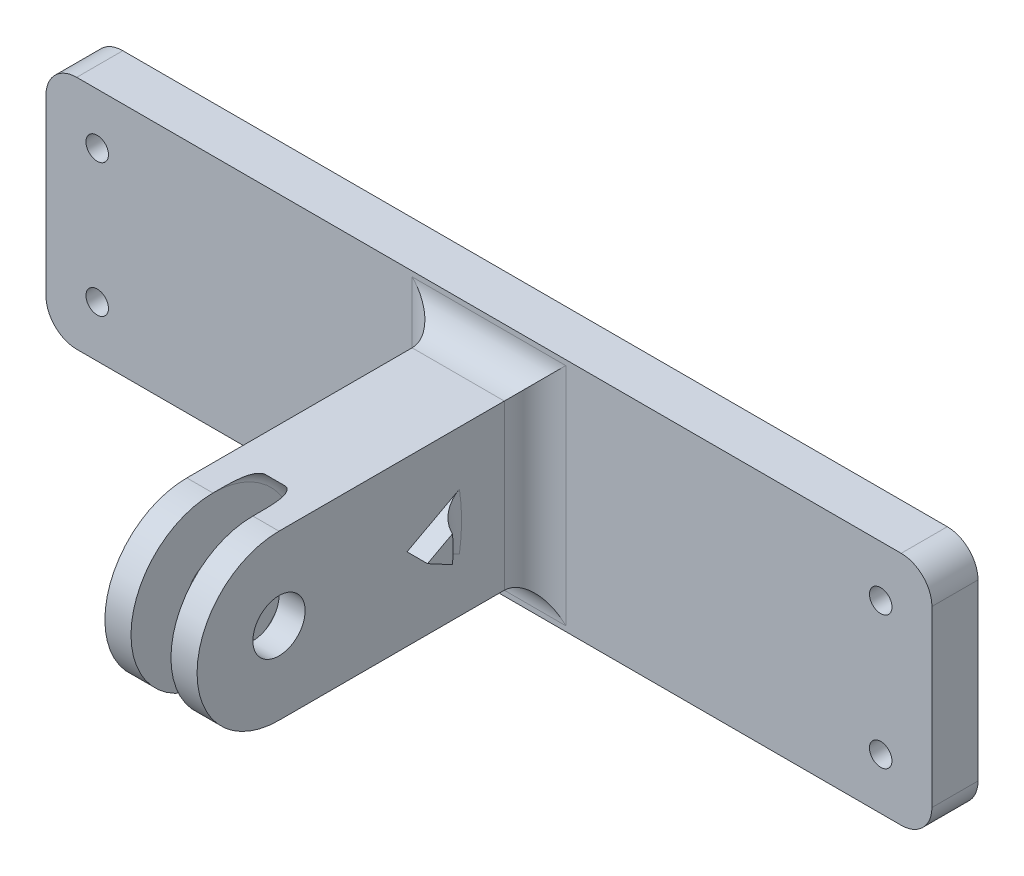
from build123d import *

# Parameters (mm, degrees)
SKETCH1_W           = 86.5
SKETCH1_H           = 23
SKETCH1_R           = 1.1
BOSS_EXTRUDE1_DEPTH = 4.5
CUT_EXTRUDE1_DEPTH  = 2
SKETCH3_R           = 2.55
BOSS_EXTRUDE2_DEPTH = 4.5
SKETCH6_R           = 9
CUT_EXTRUDE3_DEPTH  = 1.95
FILLET1_R           = 3
FILLET2_R           = 1
FILLET3_R           = 1
BOSS_EXTRUDE3_DEPTH = 2
FILLET4_R           = 3


with BuildPart() as part:
    # Sketch1 → Boss-Extrude1 (new body)
    with BuildSketch(Plane.XY):
        Rectangle(SKETCH1_W, SKETCH1_H)
        with Locations((38.25, 6.5)):
            Circle(SKETCH1_R, mode=Mode.SUBTRACT)
        with Locations((38.25, -6.5)):
            Circle(SKETCH1_R, mode=Mode.SUBTRACT)
        with Locations((-38.25, -6.5)):
            Circle(SKETCH1_R, mode=Mode.SUBTRACT)
        with Locations((-38.25, 6.5)):
            Circle(SKETCH1_R, mode=Mode.SUBTRACT)
    extrude(amount=BOSS_EXTRUDE1_DEPTH)

    # Sketch2 → Cut-Extrude1 (cut)
    with BuildSketch(Plane(origin=(0, 0, 0), x_dir=(-1, 0, 0), z_dir=(0, 0, -1))):
        with BuildLine():
            Line((-5, 9.5), (-35.604248689, 9.5))
            ThreePointArc((-35.604248689, 9.5), (-34.508342613, 5.085786438), (-38.25, 2.5))
            Line((-38.25, 2.5), (-38.25, -2.5))
            ThreePointArc((-38.25, -2.5), (-34.508342613, -5.085786438), (-35.604248689, -9.5))
            Line((-35.604248689, -9.5), (-5, -9.5))
            Line((-5, -9.5), (-5, 9.5))
        make_face()
        with BuildLine():
            Line((35.604248689, 9.5), (5, 9.5))
            Line((5, 9.5), (5, -9.5))
            Line((5, -9.5), (35.604248689, -9.5))
            ThreePointArc((35.604248689, -9.5), (34.508342613, -5.085786438), (38.25, -2.5))
            Line((38.25, -2.5), (38.25, 2.5))
            ThreePointArc((38.25, 2.5), (34.508342613, 5.085786438), (35.604248689, 9.5))
        make_face()
    extrude(amount=-CUT_EXTRUDE1_DEPTH, mode=Mode.SUBTRACT)

    # Sketch3 → Boss-Extrude2 (add, symmetric)
    with BuildSketch(Plane(origin=(0, 0, 0), x_dir=(0, 0, -1), z_dir=(1, 0, 0))):
        with BuildLine():
            Line((-29.5, 8), (-4.5, 8))
            Line((-4.5, 8), (-4.5, -8))
            Line((-4.5, -8), (-29.5, -8))
            ThreePointArc((-29.5, -8), (-37.5, 0), (-29.5, 8))
        make_face()
        with Locations((-29.5, 0)):
            Circle(SKETCH3_R, mode=Mode.SUBTRACT)
    extrude(amount=BOSS_EXTRUDE2_DEPTH, both=True)

    # Sketch6 → Cut-Extrude3 (cut, symmetric)
    with BuildSketch(Plane(origin=(0, 0, 0), x_dir=(0, 0, -1), z_dir=(1, 0, 0))):
        with Locations((-29.5, 0)):
            Circle(SKETCH6_R)
    extrude(amount=CUT_EXTRUDE3_DEPTH, both=True, mode=Mode.SUBTRACT)

    # Fillet1
    fillet1_edges = [part.edges().sort_by_distance(p)[0] for p in [
        (4.5, 0, 4.5),
        (-4.5, 0, 4.5),
        (0, -8, 4.5),
        (0, 8, 4.5),
        (43.25, -11.5, 2.25),
        (-43.25, -11.5, 2.25),
        (-43.25, 11.5, 2.25),
        (43.25, 11.5, 2.25),
    ]]
    fillet(fillet1_edges, radius=FILLET1_R)

    # Fillet2
    fillet2_edges = [part.edges().sort_by_distance(p)[0] for p in [
        (1.95, 0, 20.5),
        (-1.95, 0, 20.5),
    ]]
    fillet(fillet2_edges, radius=FILLET2_R)

    # Fillet3
    fillet3_edges = [part.edges().sort_by_distance(p)[0] for p in [
        (35.604248689, -9.5, 1),
        (38.25, -2.5, 1),
        (38.25, 2.5, 1),
        (35.604248689, 9.5, 1),
        (5, 9.5, 1),
        (5, -9.5, 1),
        (-35.604248689, -9.5, 1),
        (-5, -9.5, 1),
        (-5, 9.5, 1),
        (-35.604248689, 9.5, 1),
        (-38.25, 2.5, 1),
        (-38.25, -2.5, 1),
    ]]
    fillet(fillet3_edges, radius=FILLET3_R)

    # Sketch7 → Boss-Extrude3 (add)
    with BuildSketch(Plane(origin=(4.5, 0, 0), x_dir=(0, 0, -1), z_dir=(1, 0, 0))):
        Polygon((-14.557079529, 1.307336141), (-17, 0), (-14.557079529, 0), align=None)
        Polygon((-14.557079529, 0), (-17, 0), (-14.557079529, -1.307336141), align=None)
        with BuildLine():
            Line((-14.557079529, 0), (-14.557079529, -1.307336141))
            ThreePointArc((-14.557079529, -1.307336141), (-14.514276676, -0.65429081), (-14.5, 0))
            Line((-14.5, 0), (-14.557079529, 0))
        make_face()
        with BuildLine():
            ThreePointArc((-14.5, 0), (-14.514276676, 0.65429081), (-14.557079529, 1.307336141))
            Line((-14.557079529, 1.307336141), (-14.557079529, 0))
            Line((-14.557079529, 0), (-14.5, 0))
        make_face()
    boss_extrude3 = extrude(amount=BOSS_EXTRUDE3_DEPTH)

    # Mirror1: Boss-Extrude3 across plane
    add(boss_extrude3.mirror(Plane(origin=(0, 0, 0), x_dir=(0, 0, 1), z_dir=(1, 0, 0))))

    # Fillet4
    # the kernel refuses this fillet: 3 mm, written as the material it adds along each edge
    with BuildSketch(Plane(origin=(4.5, 0, 29.5), x_dir=(0, -0.5300616948891074, -0.8479590789721441), z_dir=(0, -0.8479590789721441, 0.5300616948891074))) as fillet4_piece_1_section:
        with BuildLine():
            CenterArc((17.828427125, 3), FILLET4_R, 199.471220634, 70.528779366)
            Line((15, 2), (14.943431458, 1.98))
            ThreePointArc((14.943431458, 1.98), (14.94, 1), (14.94, 0))
            Line((14.94, 0), (15, -0.06))
            Line((15, -0.06), (17.828427125, -0.06))
            Line((17.828427125, -0.06), (17.828427125, 0))
        make_face()
    fillet4_piece_1 = revolve(axis=Axis((4.5, 0, 29.5), (1, 0, 0)), revolution_arc=64.019246795, mode=Mode.PRIVATE)
    fillet4_piece_1 = split(fillet4_piece_1, bisect_by=Plane(origin=(4.960273163, -1.358360802, 14.461733593), z_dir=(0, 0.8816858925187555, -0.47183682235854135)), keep=Keep.TOP, mode=Mode.PRIVATE)
    fillet4_piece_1 = split(fillet4_piece_1, bisect_by=Plane(origin=(4.960273163, 1.358360693, 14.461733796), z_dir=(0, -0.8816858925186548, -0.4718368223587294)), keep=Keep.TOP, mode=Mode.PRIVATE)
    add(fillet4_piece_1)
    with BuildSketch(Plane(origin=(-4.5, 0, 29.5), x_dir=(0, -0.5300616948891074, -0.8479590789721441), z_dir=(0, -0.8479590789721441, 0.5300616948891074))) as fillet4_piece_2_section:
        with BuildLine():
            CenterArc((17.828427125, -3), FILLET4_R, 90, 70.528779366)
            Line((15, -2), (14.943431458, -1.98))
            ThreePointArc((14.943431458, -1.98), (14.94, -1), (14.94, 0))
            Line((14.94, 0), (15, 0.06))
            Line((15, 0.06), (17.828427125, 0.06))
            Line((17.828427125, 0.06), (17.828427125, 0))
        make_face()
    fillet4_piece_2 = revolve(axis=Axis((-4.5, 0, 29.5), (1, 0, 0)), revolution_arc=64.019246795, mode=Mode.PRIVATE)
    fillet4_piece_2 = split(fillet4_piece_2, bisect_by=Plane(origin=(-4.960273163, -1.358360802, 14.461733593), z_dir=(0, 0.8816858925187555, -0.47183682235854135)), keep=Keep.TOP, mode=Mode.PRIVATE)
    fillet4_piece_2 = split(fillet4_piece_2, bisect_by=Plane(origin=(-4.960273163, 1.358360693, 14.461733796), z_dir=(0, -0.8816858925186548, -0.4718368223587294)), keep=Keep.TOP, mode=Mode.PRIVATE)
    add(fillet4_piece_2)


solid = part.part
